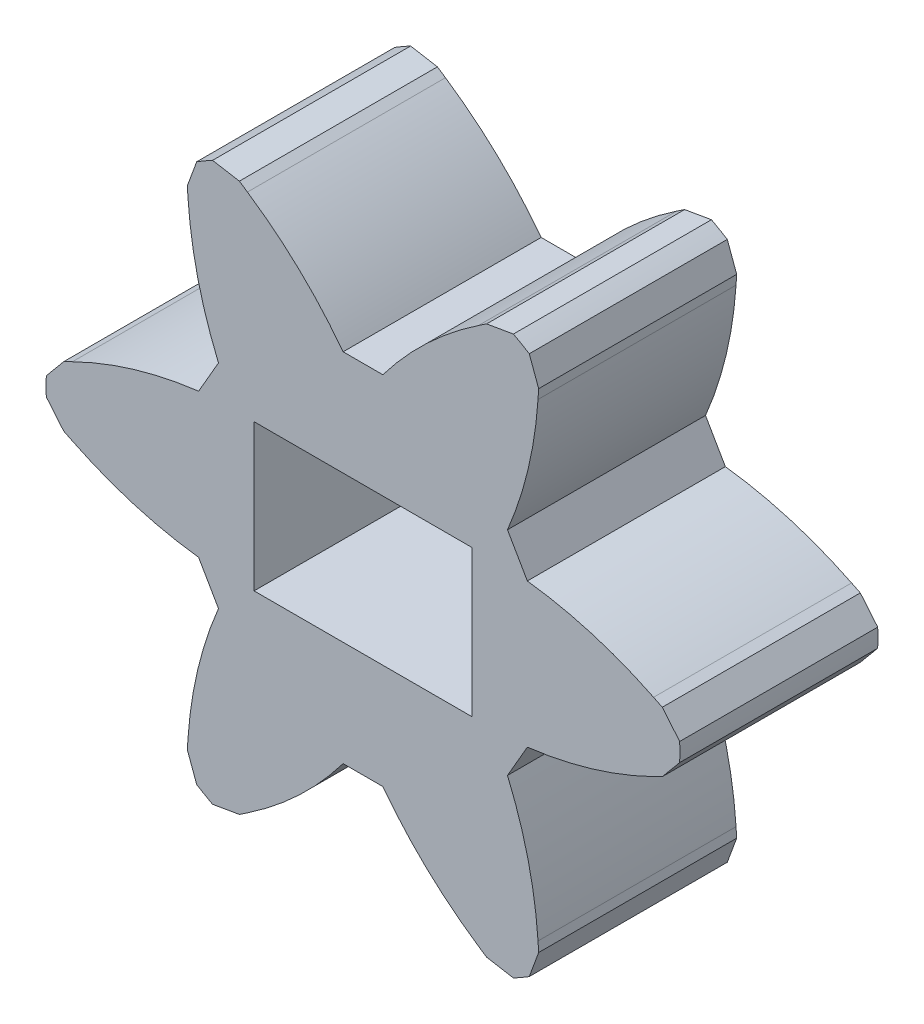
from build123d import *

# Parameters (mm, degrees)
SKETCH1_R           = 8
SKETCH1_W           = 5.5
SKETCH1_H           = 3.7
BOSS_EXTRUDE1_DEPTH = 5
CUT_EXTRUDE1_DEPTH  = 13.369316877
CIRPATTERN1_COUNT   = 6
FILLET1_R           = 10


with BuildPart() as part:
    # Sketch1 → Boss-Extrude1 (new body)
    with BuildSketch(Plane.XY):
        Circle(SKETCH1_R)
        Rectangle(SKETCH1_W, SKETCH1_H, mode=Mode.SUBTRACT)
    extrude(amount=BOSS_EXTRUDE1_DEPTH)

    # Sketch2 → Cut-Extrude1 (cut, through all)
    with BuildSketch(Plane.XY):
        Polygon((-7.331932906, 22.221764399), (0, 24.952212466), (7.331932906, 22.221764399), (3.798424573, 7.040736522), (3.120998591, 6.924019842), (1.330058439, 5.723612136), (0.501497444, 4.50257488), (-0.501497444, 4.50257488), (-1.330058439, 5.723612136), (-3.120998591, 6.924019842), (-3.798424573, 7.040736522), align=None)
    cut_extrude1 = extrude(amount=CUT_EXTRUDE1_DEPTH, mode=Mode.SUBTRACT)

    # CirPattern1: Cut-Extrude1 ×6 about axis
    cirpattern1_axis = Axis((0, 0, 0), (0, 0, 1))
    for i in range(1, CIRPATTERN1_COUNT):
        add(cut_extrude1.rotate(cirpattern1_axis, i * 360 / CIRPATTERN1_COUNT), mode=Mode.SUBTRACT)

    # Fillet1
    # the kernel refuses this fillet: 10 mm, written as the material it takes off along each edge
    with BuildSketch(Plane(origin=(-1.330058439, -5.723612136, -4.777865205), x_dir=(0.5615014183372642, 0.8274757743917586, 0), z_dir=(0, 0, 1)), Plane(origin=(5.621822731, 1.709941671, -4.777865205), x_dir=(-0.997365750808096, 0.07253660534518461, 0), z_dir=(0, 0, 1)), Plane(origin=(4.291764291, -4.013670465, -4.777865205), x_dir=(-0.43586433247083195, 0.9000123797369435, 0), z_dir=(0, 0, 1)), Plane(origin=(-5.621822731, -1.709941671, -4.777865205), x_dir=(0.997365750808096, -0.07253660534518423, 0), z_dir=(0, 0, 1)), Plane(origin=(-4.291764291, 4.013670465, -4.777865205), x_dir=(0.43586433247083256, -0.900012379736943, 0), z_dir=(0, 0, 1)), Plane(origin=(1.330058439, 5.723612136, -4.777865205), x_dir=(-0.561501418337264, -0.8274757743917588, 0), z_dir=(0, 0, 1))) as fillet1_piece_1:
        with BuildLine():
            CenterArc((1.975419419, 9.987502063), FILLET1_R, 247.992328485, 19.142820558)
            Line((-1.771887917, 0.716165173), (-1.846834064, 0.530738436))
            Line((-1.846834064, 0.530738436), (-0.074946147, -0.185426738))
            Line((-0.074946147, -0.185426738), (0, -0.2))
            ThreePointArc((0, -0.2), (0.737808461, -0.2), (1.465620873, -0.199750041))
            Line((1.465620873, -0.199750041), (1.475616922, 0))
        make_face()
    extrude(amount=14.55573041, mode=Mode.SUBTRACT)
    with BuildSketch(Plane(origin=(5.621822731, -1.709941671, -4.777865205), x_dir=(0.8975096924716217, 0.44099473003596645, 0), z_dir=(0, 0, 1)), Plane(origin=(1.330058439, -5.723612136, -4.777865205), x_dir=(0.8306674853820185, -0.5567688288052, 0), z_dir=(0, 0, 1)), Plane(origin=(-4.291764291, -4.013670465, -4.777865205), x_dir=(-0.06684220708960342, -0.9977635588411669, 0), z_dir=(0, 0, 1)), Plane(origin=(-5.621822731, 1.709941671, -4.777865205), x_dir=(-0.8975096924716216, -0.44099473003596684, 0), z_dir=(0, 0, 1)), Plane(origin=(4.291764291, 4.013670465, -4.777865205), x_dir=(0.06684220708960296, 0.9977635588411669, 0), z_dir=(0, 0, 1)), Plane(origin=(-1.330058439, 5.723612136, -4.777865205), x_dir=(-0.8306674853820185, 0.5567688288052001, 0), z_dir=(0, 0, 1))) as fillet1_piece_2:
        with BuildLine():
            CenterArc((1.911146082, 10), FILLET1_R, 250.857179442, 19.142820558)
            Line((-1.368094161, 0.552959012), (-1.433678966, 0.364018192))
            ThreePointArc((-1.433678966, 0.364018192), (-0.758993227, 0.091052768), (-0.074946147, -0.185426738))
            Line((-0.074946147, -0.185426738), (0, -0.2))
            Line((0, -0.2), (1.911146082, -0.2))
            Line((1.911146082, -0.2), (1.911146082, 0))
        make_face()
    extrude(amount=14.55573041, mode=Mode.SUBTRACT)


solid = part.part
